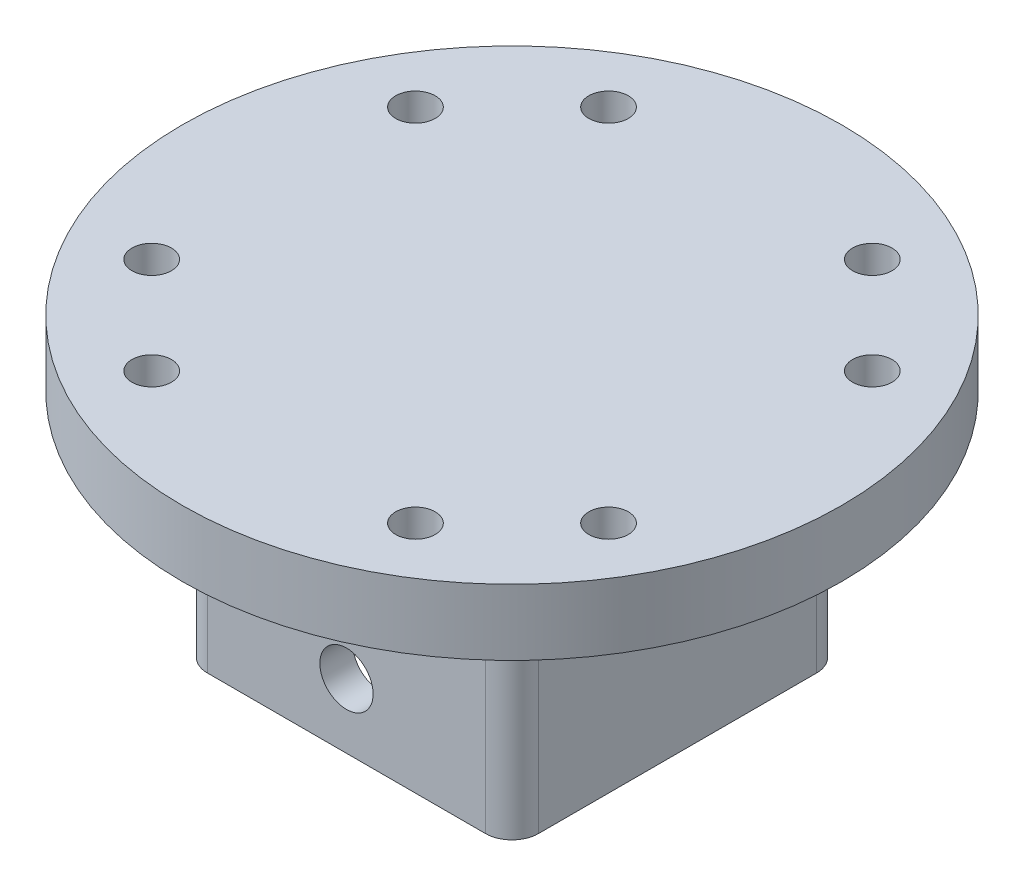
from build123d import *

# Parameters (mm, degrees)
SKETCH2_R               = 31.75
BOSS_EXTRUDE1_DEPTH     = 6.35
SKETCH3_W               = 31.877
SKETCH3_H               = 31.877
BOSS_EXTRUDE2_DEPTH     = 22.225
SKETCH4_W               = 25.527
SKETCH4_H               = 25.527
CUT_EXTRUDE1_DEPTH      = 51.100654936
SKETCH5_R               = 1.90000001
CUT_EXTRUDE2_DEPTH      = 51.100654936
CUT_EXTRUDE3_DEPTH      = 51.100654936
CUT_EXTRUDE3_DEPTH_BACK = 51.100654936
SKETCH7_R               = 2.563499953
CIRPATTERN2_COUNT       = 4
FILLET2_R               = 2.54
FILLET3_R               = 2.54


with BuildPart() as part:
    # Sketch2 → Boss-Extrude1 (new body)
    with BuildSketch(Plane(origin=(0, 0, 0), x_dir=(1, 0, 0), z_dir=(0, 1, 0))):
        Circle(SKETCH2_R)
    extrude(amount=BOSS_EXTRUDE1_DEPTH)

    # Sketch3 → Boss-Extrude2 (add)
    with BuildSketch(Plane(origin=(0, 0, 0), x_dir=(1, 0, 0), z_dir=(0, 1, 0))):
        Rectangle(SKETCH3_W, SKETCH3_H)
    extrude(amount=-BOSS_EXTRUDE2_DEPTH)

    # Sketch4 → Cut-Extrude1 (cut, through all)
    with BuildSketch(Plane(origin=(0, 0, 0), x_dir=(1, 0, 0), z_dir=(0, 1, 0))):
        Rectangle(SKETCH4_W, SKETCH4_H)
    extrude(amount=-CUT_EXTRUDE1_DEPTH, mode=Mode.SUBTRACT)

    # Sketch5 → Cut-Extrude2 (cut, through all)
    with BuildSketch(Plane(origin=(0, 0, 0), x_dir=(1, 0, 0), z_dir=(0, 1, 0))):
        with Locations((21.997045256, 12.7)):
            Circle(SKETCH5_R)
        with Locations((21.997045256, -12.7)):
            Circle(SKETCH5_R)
    cut_extrude2 = extrude(amount=CUT_EXTRUDE2_DEPTH, mode=Mode.SUBTRACT)

    # Sketch7 → Cut-Extrude3 (cut, two sides: drawn at the far end of the back side and taken through both)
    with BuildSketch(Plane.XY.offset(-CUT_EXTRUDE3_DEPTH_BACK)):
        with Locations((0, -16.002)):
            Circle(SKETCH7_R)
    extrude(amount=CUT_EXTRUDE3_DEPTH + CUT_EXTRUDE3_DEPTH_BACK, mode=Mode.SUBTRACT)

    # CirPattern2: Cut-Extrude2 ×4 about axis
    cirpattern2_axis = Axis((0, -18.783228813, 0), (0, 1, 0))
    for i in range(1, CIRPATTERN2_COUNT):
        add(cut_extrude2.rotate(cirpattern2_axis, i * 360 / CIRPATTERN2_COUNT), mode=Mode.SUBTRACT)

    # Fillet2
    fillet2_edges = [part.edges().sort_by_distance(p)[0] for p in [
        (-15.9385, -11.1125, 15.9385),
        (15.9385, -11.1125, 15.9385),
        (15.9385, -11.1125, -15.9385),
        (-15.9385, -11.1125, -15.9385),
    ]]
    fillet(fillet2_edges, radius=FILLET2_R)

    # Fillet3
    fillet3_edges = [part.edges().sort_by_distance(p)[0] for p in [
        (15.194551224, 0, -15.194551224),
        (15.9385, 0, 0),
        (15.194551224, 0, 15.194551224),
        (0, 0, 15.9385),
        (-15.194551224, 0, 15.194551224),
        (-15.9385, 0, 0),
        (-15.194551224, 0, -15.194551224),
        (0, 0, -15.9385),
    ]]
    fillet(fillet3_edges, radius=FILLET3_R)


solid = part.part
